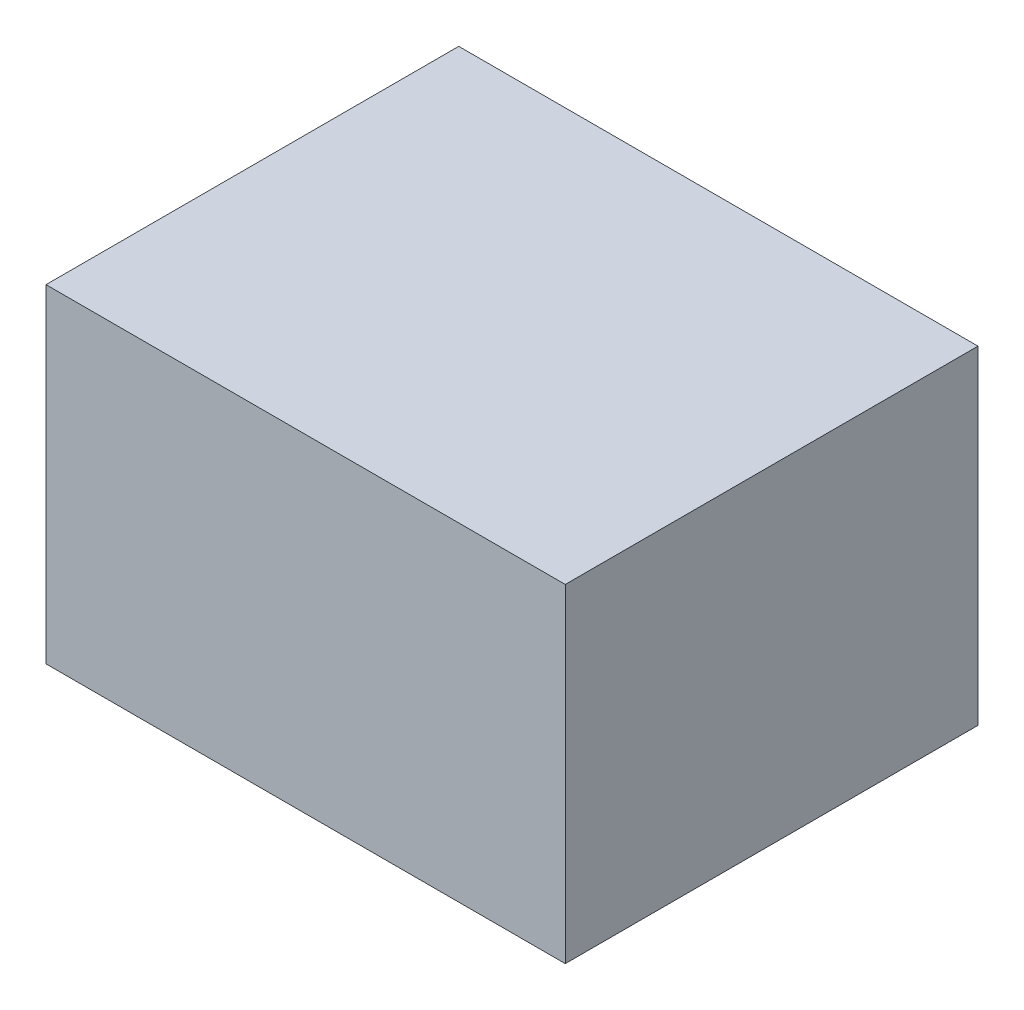
from build123d import *

# Parameters (mm, degrees)
SKETCH2_W           = 1485.9
SKETCH2_H           = 939.8
BOSS_EXTRUDE1_DEPTH = 1181.1


with BuildPart() as part:
    # Sketch2 → Boss-Extrude1 (new body)
    with BuildSketch(Plane.XY):
        with Locations((728.919852555, 461.82203632)):
            Rectangle(SKETCH2_W, SKETCH2_H)
    extrude(amount=BOSS_EXTRUDE1_DEPTH)


solid = part.part
